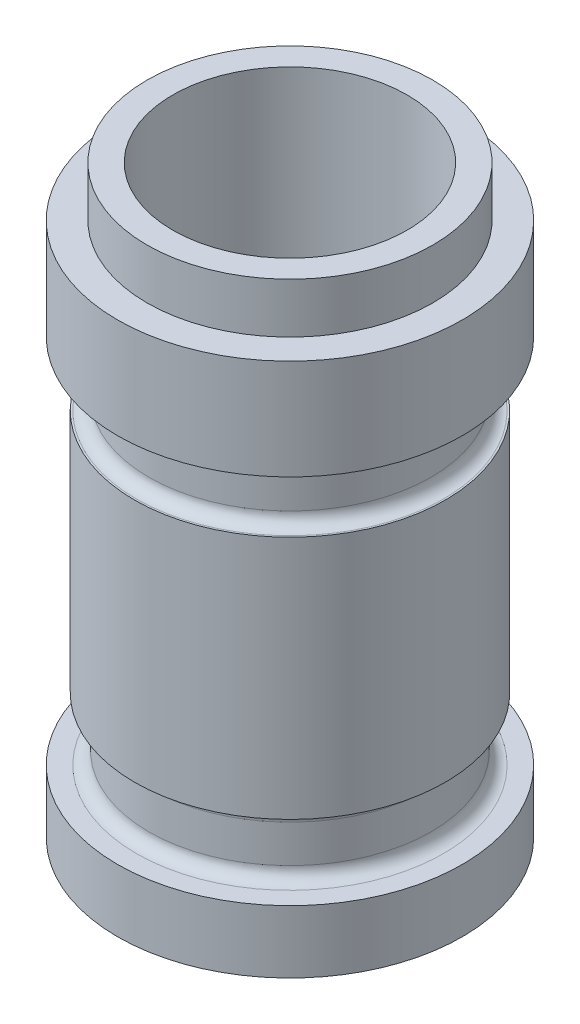
from build123d import *


with BuildPart() as part:
    # Sketch1 → Revolve1 (revolve)
    with BuildSketch(Plane.XY):
        with BuildLine():
            Line((0, 0), (0, 0.5))
            Line((0, 0.5), (1.37, 0.987858357))
            Line((1.37, 0.987858357), (1.87, 0.987858357))
            Line((1.87, 0.987858357), (1.87, 9.324006727))
            Line((1.87, 9.324006727), (2.28, 9.324006727))
            Line((2.28, 9.324006727), (2.28, 8.524006727))
            Line((2.28, 8.524006727), (2.75, 8.524006727))
            Line((2.75, 8.524006727), (2.75, 6.924006727))
            Line((2.75, 6.924006727), (2.45, 6.924006727))
            ThreePointArc((2.45, 6.924006727), (2.308578644, 6.865428083), (2.25, 6.724006727))
            Line((2.25, 6.724006727), (2.25, 6.1))
            ThreePointArc((2.25, 6.1), (2.308578644, 5.958578644), (2.45, 5.9))
            Line((2.45, 5.9), (2.479, 5.9))
            Line((2.479, 5.9), (2.479, 2))
            Line((2.479, 2), (2.45, 2))
            ThreePointArc((2.45, 2), (2.308578644, 1.941421356), (2.25, 1.8))
            Line((2.25, 1.8), (2.25, 1.2))
            ThreePointArc((2.25, 1.2), (2.308578644, 1.058578644), (2.45, 1))
            Line((2.45, 1), (2.75, 1))
            Line((2.75, 1), (2.75, 0))
            Line((2.75, 0), (0, 0))
        make_face()
    revolve(axis=Axis((0, 236.22, 0), (0, -1, 0)))


solid = part.part
